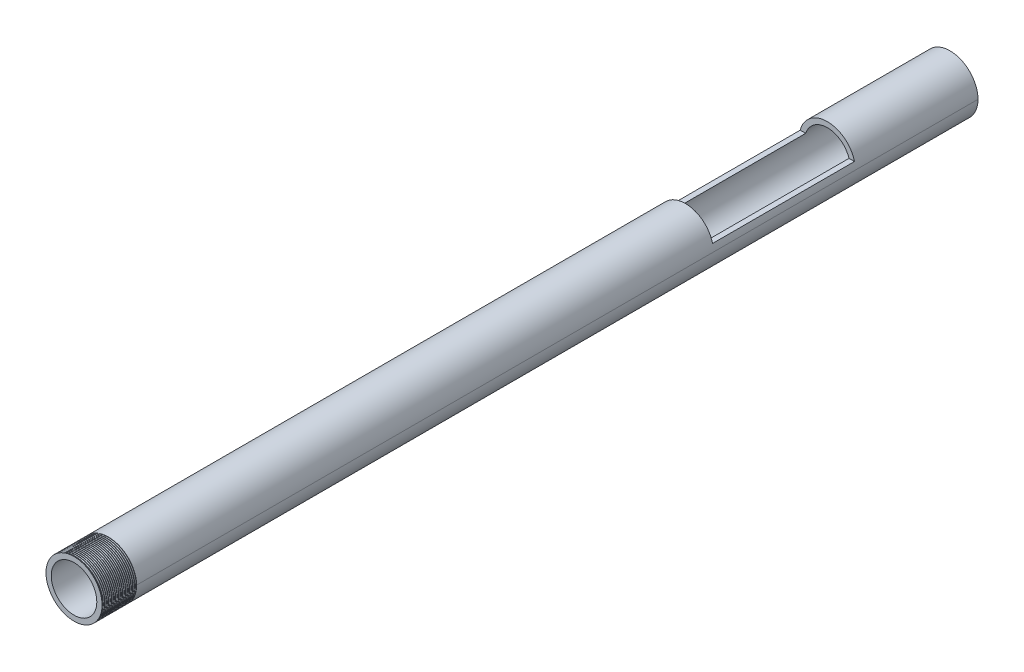
from build123d import *

# Parameters (mm, degrees)
SKETCH1_R               = 16
SKETCH1_R_2             = 13
BOSS_EXTRUDE1_DEPTH     = 500
CUT_EXTRUDE1_DEPTH      = 530
CUT_EXTRUDE1_DEPTH_BACK = 530
SKETCH2_W               = 81
SKETCH2_H               = 50
THREAD1_PITCH           = 1


with BuildPart() as part:
    # Sketch1 → Boss-Extrude1 (new body)
    with BuildSketch(Plane.XY):
        Circle(SKETCH1_R)
        Circle(SKETCH1_R_2, mode=Mode.SUBTRACT)
    extrude(amount=BOSS_EXTRUDE1_DEPTH)

    # Sketch2 → Cut-Extrude1 (cut, two sides: drawn at the far end of the back side and taken through both)
    with BuildSketch(Plane(origin=(0, 0, 0), x_dir=(0, 0, -1), z_dir=(1, 0, 0)).offset(-CUT_EXTRUDE1_DEPTH_BACK)):
        with Locations((-110.5, 29)):
            Rectangle(SKETCH2_W, SKETCH2_H)
    extrude(amount=CUT_EXTRUDE1_DEPTH + CUT_EXTRUDE1_DEPTH_BACK, mode=Mode.SUBTRACT)

    # Thread1: the profile of Thread Profile1 profile screwed along a right-hand helix of 20 turns, 8 arcs to a turn; built about Z, then put on its axis
    thread1_z = Axis((0, 0, 0), (0, 0, 1))
    thread1_corners = [(16.0003, 0, -0.000173205), (16.0003, 0, 0.218923204), (15.864683531, 0, 0.140625), (15.864683531, 0, 0.078125)]
    with BuildLine(mode=Mode.PRIVATE) as thread1_profile:
        Line(thread1_corners[0], thread1_corners[1])
        Line(thread1_corners[1], thread1_corners[2])
        Line(thread1_corners[2], thread1_corners[3])
        Line(thread1_corners[3], thread1_corners[0])
    thread1_cap = Face(thread1_profile.wire())
    thread1_turn_angles = [0, 22.5, 45, 67.5, 90, 112.5, 135, 157.5, 180, 202.5, 225, 247.5, 270, 292.5, 315, 337.5, 360]
    thread1_turn_weights = [1, 0.9238795325112867, 1, 0.9238795325112867, 1, 0.9238795325112867, 1, 0.9238795325112867, 1, 0.9238795325112867, 1, 0.9238795325112867, 1, 0.9238795325112867, 1, 0.9238795325112867, 1]
    thread1_turn_rails = [Edge.make_bspline([Vector(p[0], p[1], 0).rotate(thread1_z, thread1_turn_angles[k]) / thread1_turn_weights[k] + Vector(0, 0, p[2] + THREAD1_PITCH * thread1_turn_angles[k] / 360) for k in range(17)], [0, 0, 0, 1, 1, 2, 2, 3, 3, 4, 4, 5, 5, 6, 6, 7, 7, 8, 8, 8], 2, thread1_turn_weights) for p in thread1_corners]
    thread1_turn_sides = [Face.make_surface_from_curves(thread1_turn_rails[p[0]], thread1_turn_rails[p[1]]) for p in [(0, 1), (1, 2), (2, 3), (3, 0)]]
    thread1 = Plane(origin=(0, 0, 500), x_dir=(-1, 0, 0), z_dir=(0, 0, -1)) * Solid(Shell([*[p.moved(Location((0, 0, THREAD1_PITCH * i))) for i in range(20) for p in thread1_turn_sides], thread1_cap, thread1_cap.rotate(thread1_z, 7200).moved(Location((0, 0, THREAD1_PITCH * 7200 / 360)))]))
    add(thread1, mode=Mode.SUBTRACT)


solid = part.part
